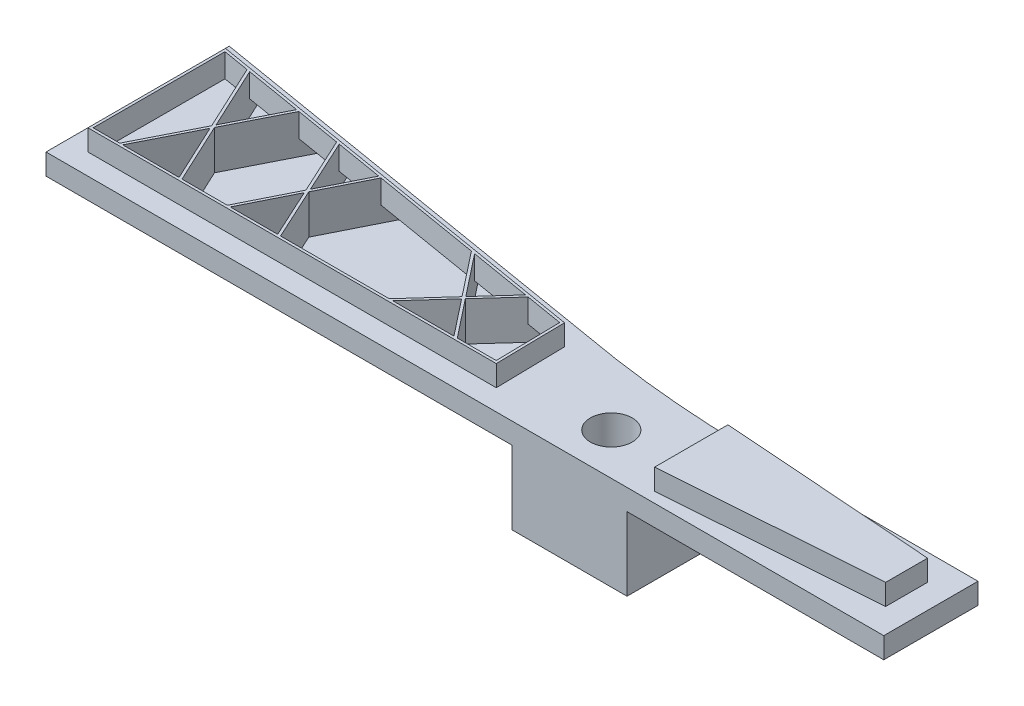
from build123d import *

# Parameters (mm, degrees)
BOSS_EXTRUDE1_DEPTH = 2
SKETCH2_W           = 11
SKETCH2_H           = 8
BOSS_EXTRUDE2_DEPTH = 7
SKETCH3_R           = 2
CUT_EXTRUDE2_DEPTH  = 83.38476801
BOSS_EXTRUDE3_DEPTH = 2
SHELL1_START        = 0.25
SHELL1_DEPTH        = 3.75
SHELL1_2_OUTLINE_R  = 2.25
SHELL1_2_DEPTH      = 1.5
SHELL1_START_2      = -6.75
SHELL1_3_OUTLINE_W  = 10.5
SHELL1_3_OUTLINE_H  = 7.5
SHELL1_3_OUTLINE_R  = 2.25
SHELL1_3_DEPTH      = 7
RIB2_REACH          = 84.627
BOSS_EXTRUDE4_DEPTH = 2


# Read off the part's stored shape, not the designer's step: Shell1
with BuildPart() as part:
    # Sketch1 → Boss-Extrude1 (new body)
    with BuildSketch(Plane(origin=(0, 0, 0), x_dir=(1, 0, 0), z_dir=(0, 1, 0))):
        with BuildLine():
            Line((0, 0), (0, 17.5))
            Line((0, 17.5), (41.207252266, 10.607357821))
            ThreePointArc((41.207252266, 10.607357821), (51.063628859, 9.311158863), (61, 9))
            Line((61, 9), (80, 9))
            Line((80, 9), (80, 0))
            Line((80, 0), (0, 0))
        make_face()
    extrude(amount=BOSS_EXTRUDE1_DEPTH)

    # Sketch2 → Boss-Extrude2 (add)
    with BuildSketch(Plane.XZ):
        with Locations((49.982902032, -4)):
            Rectangle(SKETCH2_W, SKETCH2_H)
    extrude(amount=BOSS_EXTRUDE2_DEPTH)

    # Sketch3 → Cut-Extrude2 (cut, through all)
    with BuildSketch(Plane.XZ.offset(7)):
        with Locations(Location((49.982902032, -4, 0), (0, 0, 270))):
            Circle(SKETCH3_R)
    extrude(amount=-CUT_EXTRUDE2_DEPTH, mode=Mode.SUBTRACT)

    # Sketch4 → Boss-Extrude3 (add)
    with BuildSketch(Plane(origin=(0, 2, 0), x_dir=(1, 0, 0), z_dir=(0, 1, 0))):
        Polygon((40.877300801, 8.634762569), (41, 2), (2, 2), (2, 15.137679132), align=None)
    extrude(amount=BOSS_EXTRUDE3_DEPTH)

    # Shell1 outline → Shell1 (cut)
    with BuildSketch(Plane(origin=(0, 0, 0), x_dir=(1, 0, 0), z_dir=(0, 1, 0)).offset(SHELL1_START)):
        Polygon((2.25, 2.25), (40.745333907, 2.25), (40.631184307, 8.422456723), (2.25, 14.842389024), align=None)
    extrude(amount=SHELL1_DEPTH, mode=Mode.SUBTRACT)

    # Shell1 2 outline → Shell1 2 (cut)
    with BuildSketch(Plane(origin=(0, 0, 0), x_dir=(1, 0, 0), z_dir=(0, 1, 0)).offset(SHELL1_START)):
        with BuildLine():
            Line((79.75, 0.25), (79.75, 8.75))
            Line((79.75, 8.75), (61.002301351, 8.75))
            ThreePointArc((61.002301351, 8.75), (51.043164326, 9.06199776), (41.164190751, 10.361087437))
            Line((41.164190751, 10.361087437), (0.25, 17.204709892))
            Line((0.25, 17.204709892), (0.25, 0.25))
            Line((0.25, 0.25), (79.75, 0.25))
        make_face()
        Polygon((40.631184307, 8.422456723), (40.745333907, 2.25), (2.25, 2.25), (2.25, 14.842389024), align=None, mode=Mode.SUBTRACT)
        with Locations((49.982902032, 4)):
            Circle(SHELL1_2_OUTLINE_R, mode=Mode.SUBTRACT)
    extrude(amount=SHELL1_2_DEPTH, mode=Mode.SUBTRACT)

    # Shell1 3 outline → Shell1 3 (cut)
    with BuildSketch(Plane(origin=(0, 0, 0), x_dir=(1, 0, 0), z_dir=(0, 1, 0)).offset(SHELL1_START_2)):
        with Locations((49.982902032, 4)):
            Rectangle(SHELL1_3_OUTLINE_W, SHELL1_3_OUTLINE_H)
        with Locations((49.982902032, 4)):
            Circle(SHELL1_3_OUTLINE_R, mode=Mode.SUBTRACT)
    extrude(amount=SHELL1_3_DEPTH, mode=Mode.SUBTRACT)

    # Sketch8 walls → Rib2 (add, up to next)
    with BuildSketch(Plane(origin=(0, 4, 0), x_dir=(1, 0, 0), z_dir=(0, 1, 0)), mode=Mode.PRIVATE) as rib2_sk1:
        Polygon((-30.5404545, 90.126090222), (45.840432464, -73.587738012), (46.06698827, -73.482038123), (-30.313898694, 90.231790111), align=None)
    rib2_tool1 = extrude(rib2_sk1.sketch, amount=-RIB2_REACH, mode=Mode.PRIVATE) - part.part
    # Sketch8 walls → Rib2 (add, up to next)
    with BuildSketch(Plane(origin=(0, 4, 0), x_dir=(1, 0, 0), z_dir=(0, 1, 0)), mode=Mode.PRIVATE) as rib2_sk2:
        Polygon((48.244103521, 88.119990894), (-32.940634825, -72.310767507), (-32.717569751, -72.423647853), (48.467168595, 88.007110547), align=None)
    rib2_tool2 = extrude(rib2_sk2.sketch, amount=-RIB2_REACH, mode=Mode.PRIVATE) - part.part
    # Sketch8 walls → Rib2 (add, up to next)
    with BuildSketch(Plane(origin=(0, 4, 0), x_dir=(1, 0, 0), z_dir=(0, 1, 0)), mode=Mode.PRIVATE) as rib2_sk3:
        Polygon((-19.945501862, 88.559114212), (54.930872718, -73.737760739), (55.15787846, -73.633030645), (-19.718496119, 88.663844307), align=None)
    rib2_tool3 = extrude(rib2_sk3.sketch, amount=-RIB2_REACH, mode=Mode.PRIVATE) - part.part
    # Sketch8 walls → Rib2 (add, up to next)
    with BuildSketch(Plane(origin=(0, 4, 0), x_dir=(1, 0, 0), z_dir=(0, 1, 0)), mode=Mode.PRIVATE) as rib2_sk4:
        Polygon((57.294710169, 86.727791097), (-22.305946259, -72.494493497), (-22.082333571, -72.606285115), (57.518322857, 86.615999479), align=None)
    rib2_tool4 = extrude(rib2_sk4.sketch, amount=-RIB2_REACH, mode=Mode.PRIVATE) - part.part
    # Sketch8 walls → Rib2 (add, up to next)
    with BuildSketch(Plane(origin=(0, 4, 0), x_dir=(1, 0, 0), z_dir=(0, 1, 0)), mode=Mode.PRIVATE) as rib2_sk5:
        Polygon((-21.175633704, 75.686160498), (88.535096121, -63.505624935), (88.731438538, -63.350868173), (-20.979291286, 75.840917259), align=None)
    rib2_tool5 = extrude(rib2_sk5.sketch, amount=-RIB2_REACH, mode=Mode.PRIVATE) - part.part
    # Sketch8 walls → Rib2 (add, up to next)
    with BuildSketch(Plane(origin=(0, 4, 0), x_dir=(1, 0, 0), z_dir=(0, 1, 0)), mode=Mode.PRIVATE) as rib2_sk6:
        Polygon((92.986420538, 71.052239579), (-25.615710829, -59.5819061), (-25.430615704, -59.749953101), (93.171515663, 70.884192578), align=None)
    rib2_tool6 = extrude(rib2_sk6.sketch, amount=-RIB2_REACH, mode=Mode.PRIVATE) - part.part
    add(rib2_tool1.solids().sort_by_distance((7.763266885, 4, -8.32202605))[0])
    add(rib2_tool2.solids().sort_by_distance((7.763266885, 4, -7.84817152))[0])
    add(rib2_tool3.solids().sort_by_distance((17.606188299, 4, -7.463041784))[0])
    add(rib2_tool4.solids().sort_by_distance((17.606188299, 4, -7.060752991))[0])
    add(rib2_tool5.solids().sort_by_distance((33.777902417, 4, -6.167646162))[0])
    add(rib2_tool6.solids().sort_by_distance((33.777902417, 4, -5.651143239))[0])

    # Sketch9 → Boss-Extrude4 (add)
    with BuildSketch(Plane(origin=(0, 2, 0), x_dir=(1, 0, 0), z_dir=(0, 1, 0))):
        Polygon((77.681321794, 6.50188709), (77.681321794, 2.50188709), (57.121277642, 1), (57.121277642, 8.00377418), align=None)
    extrude(amount=BOSS_EXTRUDE4_DEPTH)


solid = part.part
